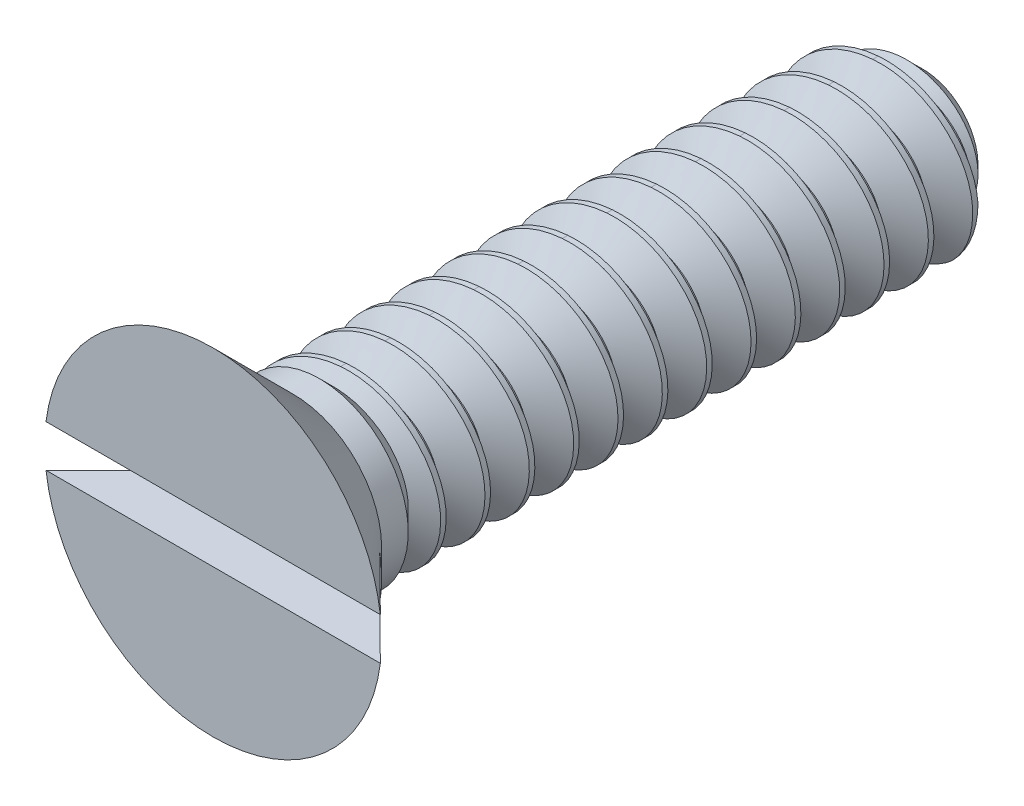
from build123d import *
from build123d.topology import SkipClean

# Parameters (mm, degrees)
SKETCH1_R        = 0.95
EXTRUDE3_DEPTH   = 0.6
SKETCH4_W        = 4
SKETCH4_H        = 0.5
CUT_SWEEP1_PITCH = 0.25
SKETCH26_R       = 0.25
EXTRUDE8_DEPTH   = 0.6
SKETCH12_W       = 1.9
SKETCH12_H       = 0.2375
EXTRUDE12_DEPTH  = 0.3


with BuildPart() as part:
    # Sketch1 → Extrude3 (new body)
    with BuildSketch(Plane.XY):
        Circle(SKETCH1_R)
    extrude(amount=EXTRUDE3_DEPTH)

    # Sketch11 → Cut-Revolve3 (revolve, cut)
    with BuildSketch(Plane(origin=(0, 0, 0), x_dir=(0, 0, -1), z_dir=(1, 0, 0)), mode=Mode.PRIVATE) as cut_revolve3_sk:
        Polygon((0, 0.35), (-0.6, 0.95), (0, 0.95), align=None)
    revolve(cut_revolve3_sk.sketch.rotate(Axis((0, 0, -0.441444004), (0, 0, 1)), 90), axis=Axis((0, 0, -0.441444004), (0, 0, 1)), mode=Mode.SUBTRACT)

    # Extrude10: read off the stored shape, not the designer's step
    # Extrude10 outline → Extrude10 (revolve)
    with BuildSketch(Plane.XZ):
        Polygon((0.5, 0), (0.5, 0.15), (0.35, 0.15), (0.35, 0), (0, 0), (0, -0.5), align=None)
    revolve(axis=Axis((0, 0, 0), (0, 0, 1)))



with BuildPart() as body_2:
    # Sketch4 → Revolve1 (revolve)
    with BuildSketch(Plane(origin=(0, 0, 0), x_dir=(0, 0, -1), z_dir=(1, 0, 0)), mode=Mode.PRIVATE) as revolve1_sk:
        with Locations((1.4, 0.25)):
            Rectangle(SKETCH4_W, SKETCH4_H)
    revolve(revolve1_sk.sketch.rotate(Axis((0, 0, 0.6), (0, 0, -1)), 180), axis=Axis((0, 0, 0.6), (0, 0, -1)))

    # Cut-Sweep1: arcs per turn and ends read off the stored shape
    # Cut-Sweep1: the profile of Sketch14 profile screwed along a right-hand helix through 16 turns, 6 arcs to a turn; built about Z, then put on its axis
    cut_sweep1_z = Axis((0, 0, 0), (0, 0, 1))
    cut_sweep1_corners = [(0.5003, 3.49e-07, -0.18733368), (0.5003, 3.49e-07, -0.406416265), (0.330870523, 2.31e-07, -0.312499972), (0.330870523, 2.31e-07, -0.281249972)]
    with BuildLine(mode=Mode.PRIVATE) as cut_sweep1_profile:
        Line(cut_sweep1_corners[0], cut_sweep1_corners[1])
        Line(cut_sweep1_corners[1], cut_sweep1_corners[2])
        Line(cut_sweep1_corners[2], cut_sweep1_corners[3])
        Line(cut_sweep1_corners[3], cut_sweep1_corners[0])
    cut_sweep1_cap = Face(cut_sweep1_profile.wire())
    cut_sweep1_turn_angles = [0, 30, 60, 90, 120, 150, 180, 210, 240, 270, 300, 330, 360]
    cut_sweep1_turn_weights = [1, 0.8660254037844387, 1, 0.8660254037844387, 1, 0.8660254037844387, 1, 0.8660254037844387, 1, 0.8660254037844387, 1, 0.8660254037844387, 1]
    cut_sweep1_turn_rails = [Edge.make_bspline([Vector(p[0], p[1], 0).rotate(cut_sweep1_z, cut_sweep1_turn_angles[k]) / cut_sweep1_turn_weights[k] + Vector(0, 0, p[2] + CUT_SWEEP1_PITCH * cut_sweep1_turn_angles[k] / 360) for k in range(13)], [0, 0, 0, 1, 1, 2, 2, 3, 3, 4, 4, 5, 5, 6, 6, 6], 2, cut_sweep1_turn_weights) for p in cut_sweep1_corners]
    cut_sweep1_turn_sides = [Face.make_surface_from_curves(cut_sweep1_turn_rails[p[0]], cut_sweep1_turn_rails[p[1]]) for p in [(0, 1), (1, 2), (2, 3), (3, 0)]]
    cut_sweep1 = Plane(origin=(0, 0, -3.4), x_dir=(-1, 0, 0), z_dir=(0, 0, 1)) * Solid(Shell([*[p.moved(Location((0, 0, CUT_SWEEP1_PITCH * i))) for i in range(16) for p in cut_sweep1_turn_sides], cut_sweep1_cap, cut_sweep1_cap.rotate(cut_sweep1_z, 5760).moved(Location((0, 0, CUT_SWEEP1_PITCH * 5760 / 360)))]))
    add(cut_sweep1, mode=Mode.SUBTRACT)

    # Sketch19 → Cut-Revolve4 (revolve, cut)
    with BuildSketch(Plane(origin=(0, 0, 0), x_dir=(0, 0, -1), z_dir=(1, 0, 0)), mode=Mode.PRIVATE) as cut_revolve4_sk:
        Polygon((3.4, 0.5), (3.2125, 0.5), (3.4, 0.3125), align=None)
    revolve(cut_revolve4_sk.sketch.rotate(Axis((0, 0, 0.6), (0, 0, -1)), 180), axis=Axis((0, 0, 0.6), (0, 0, -1)), mode=Mode.SUBTRACT)


with BuildPart() as part_1:
    with SkipClean():  # the faces are left unmerged after this step: merging them gives an invalid solid
        add(part.part)

        add(body_2.part)  # Extrude8 merges body 2
        # Sketch26 → Extrude8 (add)
        with BuildSketch(Plane.XY.offset(0.6)):
            Circle(SKETCH26_R)
        extrude(amount=-EXTRUDE8_DEPTH)

    # Sketch12 → Extrude12 (cut)
    with SkipClean():  # the faces are left unmerged after this step: merging them gives an invalid solid
        with BuildSketch(Plane.XY.offset(0.6)):
            Rectangle(SKETCH12_W, SKETCH12_H)
        extrude(amount=-EXTRUDE12_DEPTH, mode=Mode.SUBTRACT)


solid = part_1.part
